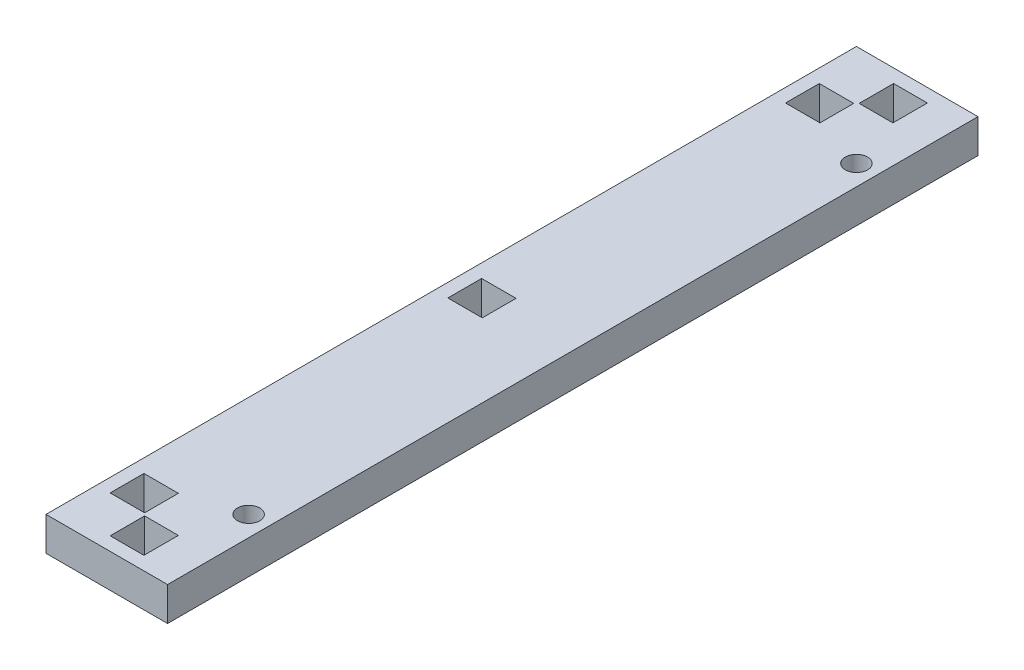
from build123d import *

# Parameters (mm, degrees)
SKETCH1_W                  = 18
SKETCH1_H                  = 120
BOSS_EXTRUDE1_DEPTH        = 5
F_3_3_3_3_DIAMETER_HOLE1_D = 3.3
SKETCH5_W                  = 5.1
SKETCH5_H                  = 5
SKETCH5_W_2                = 5
SKETCH5_H_2                = 5.1
CUT_EXTRUDE1_DEPTH         = 61.876925021


with BuildPart() as part:
    # Sketch1 → Boss-Extrude1 (new body)
    with BuildSketch(Plane(origin=(0, 0, 0), x_dir=(1, 0, 0), z_dir=(0, 1, 0))):
        Rectangle(SKETCH1_W, SKETCH1_H)
    extrude(amount=BOSS_EXTRUDE1_DEPTH)

    # Ø3.3 (3.3) Diameter Hole1 (through all)
    with Locations(Plane(origin=(0, 5, 0), x_dir=(1, 0, 0), z_dir=(0, 1, 0))):
        with Locations((6, 45), (6, -45)):
            Hole(F_3_3_3_3_DIAMETER_HOLE1_D / 2)

    # Sketch5 → Cut-Extrude1 (cut, through all)
    with BuildSketch(Plane(origin=(0, 5, 0), x_dir=(1, 0, 0), z_dir=(0, 1, 0))):
        with Locations((-4.45, 50)):
            Rectangle(SKETCH5_W, SKETCH5_H)
        with Locations((-4.45, -50)):
            Rectangle(SKETCH5_W, SKETCH5_H)
        with Locations((1, -55.45)):
            Rectangle(SKETCH5_W_2, SKETCH5_H_2)
        with Locations((1, 55.45)):
            Rectangle(SKETCH5_W_2, SKETCH5_H_2)
        with Locations((-4.45, 0)):
            Rectangle(SKETCH5_W, SKETCH5_H)
    extrude(amount=-CUT_EXTRUDE1_DEPTH, mode=Mode.SUBTRACT)


solid = part.part
